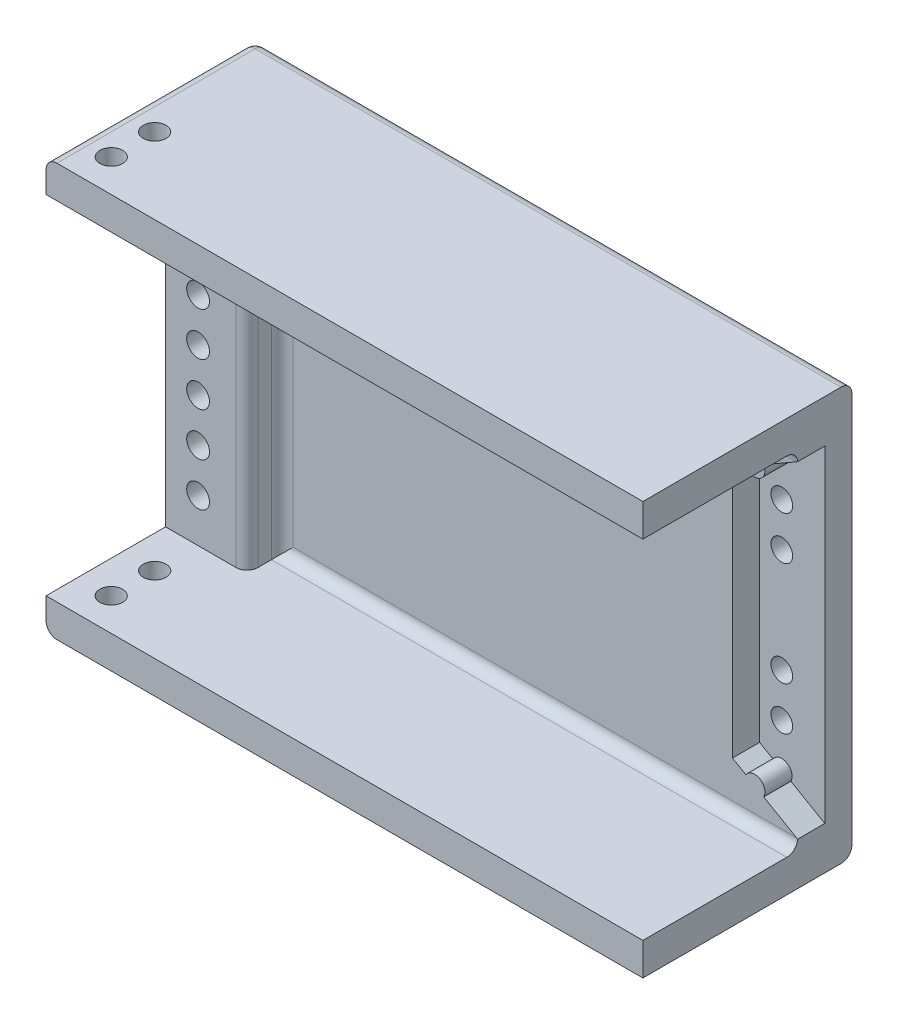
from build123d import *

# Parameters (mm, degrees)
SKETCH_2_W               = 109.92
SKETCH_2_H               = 76
EXTRUDE_1_DEPTH          = 10
CUT_EXTRUDE_1_DEPTH      = 5
SKETCH_4_R               = 2
CUT_EXTRUDE_2_DEPTH      = 92.808295873
SKETCH_5_W               = 109.92
SKETCH_5_H               = 6
EXTRUDE_2_DEPTH          = 28.5
SKETCH_6_W               = 15
SKETCH_6_H               = 64
EXTRUDE_3_DEPTH          = 6.5
CUT_EXTRUDE_3_DEPTH      = 105.577891178
CUT_EXTRUDE_3_DEPTH_BACK = 105.577891178
SKETCH_7_R               = 2.1
SKETCH_9_R               = 2.1
CUT_EXTRUDE_4_DEPTH      = 95.274934055
CUT_EXTRUDE_5_DEPTH      = 5
FILLET_1_R               = 2


with BuildPart() as part:
    # 草圖2 → 填料-伸長1 (new body)
    with BuildSketch(Plane.XY):
        with Locations((12.52544527, 24.044160626)):
            Rectangle(SKETCH_2_W, SKETCH_2_H)
    extrude(amount=EXTRUDE_1_DEPTH)

    # 草圖3 → 除料-伸長1 (cut)
    with BuildSketch(Plane.XY.offset(10)):
        with BuildLine():
            Line((67.48544527, -6.055839374), (67.48544527, 54.144160626))
            Line((67.48544527, 54.144160626), (61.24181631, 50.538464901))
            ThreePointArc((61.24181631, 50.538464901), (61.408690367, 50.105080914), (61.46544527, 49.644160626))
            ThreePointArc((61.46544527, 49.644160626), (60.088104264, 47.81746208), (57.95299519, 48.639170705))
            Line((57.95299519, 48.639170705), (55.48544527, 47.214160626))
            Line((55.48544527, 47.214160626), (55.48544527, 0.874160626))
            Line((55.48544527, 0.874160626), (57.95299519, -0.550849453))
            ThreePointArc((57.95299519, -0.550849453), (60.088104264, 0.270859171), (61.46544527, -1.555839374))
            ThreePointArc((61.46544527, -1.555839374), (61.408690367, -2.016759663), (61.24181631, -2.45014365))
            Line((61.24181631, -2.45014365), (67.48544527, -6.055839374))
        make_face()
    extrude(amount=-CUT_EXTRUDE_1_DEPTH, mode=Mode.SUBTRACT)

    # 草圖4 → 除料-伸長2 (cut, through all)
    with BuildSketch(Plane.XY.offset(5)):
        with Locations((59.56544527, 41.644160626)):
            Circle(SKETCH_4_R)
        with Locations((59.56544527, 33.644160626)):
            Circle(SKETCH_4_R)
        with Locations((59.56544527, 6.444160626)):
            Circle(SKETCH_4_R)
        with Locations((59.56544527, 14.444160626)):
            Circle(SKETCH_4_R)
    extrude(amount=-CUT_EXTRUDE_2_DEPTH, mode=Mode.SUBTRACT)

    # 草圖5 → 填料-伸長2 (add)
    with BuildSketch(Plane.XY.offset(10)):
        with Locations((12.52544527, -10.955839374)):
            Rectangle(SKETCH_5_W, SKETCH_5_H)
        with Locations((12.52544527, 59.044160626)):
            Rectangle(SKETCH_5_W, SKETCH_5_H)
    extrude(amount=EXTRUDE_2_DEPTH)

    # 草圖6 → 填料-伸長3 (add)
    with BuildSketch(Plane.XY.offset(10)):
        with Locations((-34.93455473, 24.044160626)):
            Rectangle(SKETCH_6_W, SKETCH_6_H)
    extrude(amount=EXTRUDE_3_DEPTH)

    # 草圖7 → 除料-伸長3 (cut, two sides: drawn at the far end of the back side and taken through both)
    with BuildSketch(Plane(origin=(0, -7.955839374, 0), x_dir=(1, 0, 0), z_dir=(0, 1, 0)).offset(-CUT_EXTRUDE_3_DEPTH_BACK)):
        with Locations(Location((-36.43455473, -24.5, 0), (0, 0, 270))):
            Circle(SKETCH_7_R)
        with Locations(Location((-36.43455473, -32.5, 0), (0, 0, 270))):
            Circle(SKETCH_7_R)
    extrude(amount=CUT_EXTRUDE_3_DEPTH + CUT_EXTRUDE_3_DEPTH_BACK, mode=Mode.SUBTRACT)

    # 草圖9 → 除料-伸長4 (cut, through all)
    with BuildSketch(Plane.XY.offset(16.5)):
        with Locations((-36.43455473, 0.044160626)):
            Circle(SKETCH_9_R)
        with Locations((-36.43455473, 8.044160626)):
            Circle(SKETCH_9_R)
        with Locations((-36.43455473, 16.044160626)):
            Circle(SKETCH_9_R)
        with Locations((-36.43455473, 24.044160626)):
            Circle(SKETCH_9_R)
        with Locations((-36.43455473, 32.044160626)):
            Circle(SKETCH_9_R)
        with Locations((-36.43455473, 40.044160626)):
            Circle(SKETCH_9_R)
        with Locations((-36.43455473, 48.044160626)):
            Circle(SKETCH_9_R)
    extrude(amount=-CUT_EXTRUDE_4_DEPTH, mode=Mode.SUBTRACT)

    # 草圖10 → 除料-伸長5 (cut)
    with BuildSketch(Plane(origin=(0, 0, 0), x_dir=(-1, 0, 0), z_dir=(0, 0, -1))):
        with BuildLine():
            Line((32.43455473, 0.044160626), (32.43455473, 48.044160626))
            ThreePointArc((32.43455473, 48.044160626), (36.43455473, 52.044160626), (40.43455473, 48.044160626))
            Line((40.43455473, 48.044160626), (40.43455473, 0.044160626))
            ThreePointArc((40.43455473, 0.044160626), (36.43455473, -3.955839374), (32.43455473, 0.044160626))
        make_face()
    extrude(amount=-CUT_EXTRUDE_5_DEPTH, mode=Mode.SUBTRACT)

    # 圓角1
    fillet_1_edges = [part.edges().sort_by_distance(p)[0] for p in [
        (-27.43455473, 24.044160626, 16.5),
        (-27.43455473, 24.044160626, 10),
        (20.02544527, 56.044160626, 10),
        (20.02544527, -7.955839374, 10),
        (-42.43455473, 62.044160626, 19.25),
        (-42.43455473, -13.955839374, 19.25),
        (-42.43455473, 24.044160626, 0),
        (12.52544527, -13.955839374, 0),
        (12.52544527, 62.044160626, 0),
    ]]
    fillet(fillet_1_edges, radius=FILLET_1_R - 0.0001)  # a hair under: the kernel refuses the full size


solid = part.part
